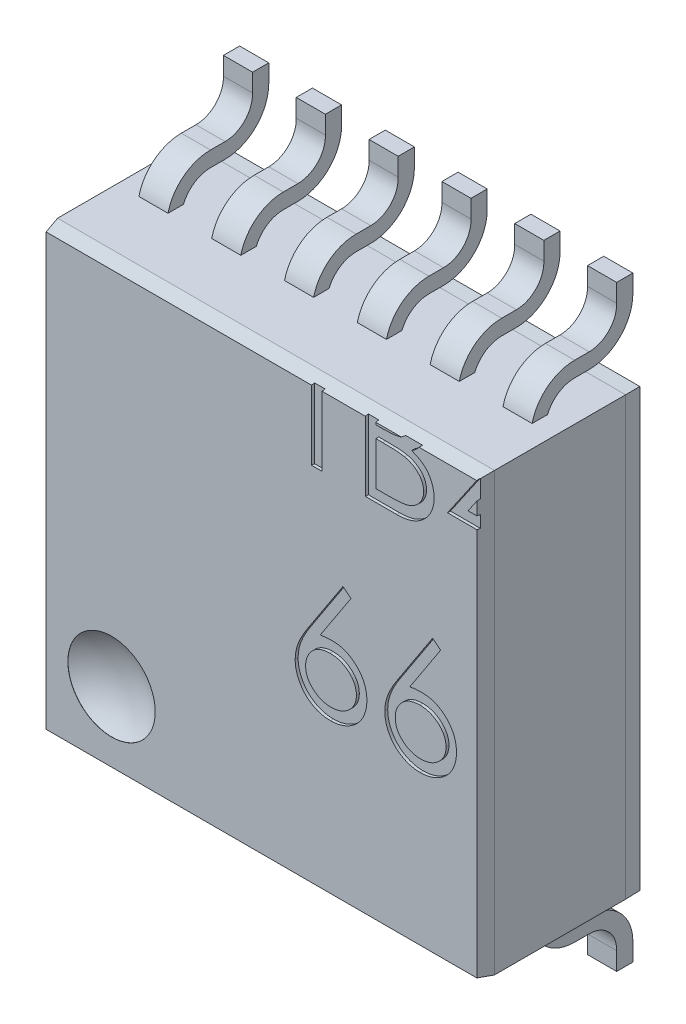
from build123d import *
from OCP.BRepFilletAPI import BRepFilletAPI_MakeChamfer

# Parameters (mm, degrees)
SKETCH1_W          = 3
SKETCH1_H          = 3
EXTRUDE2_DEPTH     = 1.1
CHAMFER2_SIZE      = 0.1
CHAMFER2_SIZE2     = 0.021255656
CHAMFER3_SIZE      = 0.1
CHAMFER3_SIZE2     = 0.001745506
SKETCH2_W          = 0.2
SKETCH2_H          = 0.548769717
EXTRUDE3_DEPTH     = 0.7
EXTRUDE3_2_DEPTH   = 0.7
EXTRUDE3_3_DEPTH   = 0.7
EXTRUDE3_4_DEPTH   = 0.7
EXTRUDE3_5_DEPTH   = 0.7
EXTRUDE3_6_DEPTH   = 0.7
EXTRUDE4_DEPTH     = 5.17080471
MIRROR1_START      = -3.15
MIRROR1_DEPTH      = 0.2
MIRROR1_START_2    = -2.65
MIRROR1_2_DEPTH    = 0.2
MIRROR1_START_3    = -2.15
MIRROR1_3_DEPTH    = 0.2
MIRROR1_START_4    = -1.65
MIRROR1_4_DEPTH    = 0.2
MIRROR1_START_5    = -1.15
MIRROR1_5_DEPTH    = 0.2
MIRROR1_START_6    = -0.65
MIRROR1_6_DEPTH    = 0.2
SKETCH4_R          = 0.3
EXTRUDE5_DEPTH     = 0.001
DOME1_FACE_RADIUS  = 0.3
DOME1_HEIGHT       = 0.1
CUT_EXTRUDE1_DEPTH = 0.02


# Read off the part's stored shape, not the designer's step: Mirror1
with BuildPart() as part:
    # Sketch1 → Extrude2 (new body)
    with BuildSketch(Plane.XY.offset(0.1)):
        with Locations((-1.8, -0.75)):
            Rectangle(SKETCH1_W, SKETCH1_H)
    extrude(amount=EXTRUDE2_DEPTH)

    # Chamfer2: one chamfer whose edges measure the first distance from different faces: ONE call of the kernel's chamfer builder (chamfer() names one face for all edges)
    chamfer2_edges_1 = [part.edges().sort_by_distance(p)[0] for p in [
        (-0.3, -0.75, 1.2),
    ]]
    chamfer2_side_1 = [part.faces().sort_by_distance(p)[0] for p in [
        (-0.3, -0.75, 0.65),
    ]]
    chamfer2_edges_2 = [part.edges().sort_by_distance(p)[0] for p in [
        (-1.8, 0.75, 1.2),
    ]]
    chamfer2_side_2 = [part.faces().sort_by_distance(p)[0] for p in [
        (-1.8, 0.75, 0.65),
    ]]
    chamfer2_edges_3 = [part.edges().sort_by_distance(p)[0] for p in [
        (-3.3, -0.75, 1.2),
    ]]
    chamfer2_side_3 = [part.faces().sort_by_distance(p)[0] for p in [
        (-3.3, -0.75, 0.65),
    ]]
    chamfer2_edges_4 = [part.edges().sort_by_distance(p)[0] for p in [
        (-1.8, -2.25, 1.2),
    ]]
    chamfer2_side_4 = [part.faces().sort_by_distance(p)[0] for p in [
        (-1.8, -2.25, 0.65),
    ]]
    chamfer2 = BRepFilletAPI_MakeChamfer(part.part.solid().wrapped)
    for e in chamfer2_edges_1:
        chamfer2.Add(CHAMFER2_SIZE, CHAMFER2_SIZE2, e.wrapped, chamfer2_side_1[0].wrapped)  # the first distance lies on this face
    for e in chamfer2_edges_2:
        chamfer2.Add(CHAMFER2_SIZE, CHAMFER2_SIZE2, e.wrapped, chamfer2_side_2[0].wrapped)  # the first distance lies on this face
    for e in chamfer2_edges_3:
        chamfer2.Add(CHAMFER2_SIZE, CHAMFER2_SIZE2, e.wrapped, chamfer2_side_3[0].wrapped)  # the first distance lies on this face
    for e in chamfer2_edges_4:
        chamfer2.Add(CHAMFER2_SIZE, CHAMFER2_SIZE2, e.wrapped, chamfer2_side_4[0].wrapped)  # the first distance lies on this face
    add(Compound.cast(chamfer2.Shape()), mode=Mode.REPLACE)

    # Chamfer3: one chamfer whose edges measure the first distance from different faces: ONE call of the kernel's chamfer builder (chamfer() names one face for all edges)
    chamfer3_edges_1 = [part.edges().sort_by_distance(p)[0] for p in [
        (-1.8, 0.75, 0.1),
    ]]
    chamfer3_side_1 = [part.faces().sort_by_distance(p)[0] for p in [
        (-1.8, 0.75, 0.6),
    ]]
    chamfer3_edges_2 = [part.edges().sort_by_distance(p)[0] for p in [
        (-0.3, -0.75, 0.1),
    ]]
    chamfer3_side_2 = [part.faces().sort_by_distance(p)[0] for p in [
        (-0.3, -0.75, 0.6),
    ]]
    chamfer3_edges_3 = [part.edges().sort_by_distance(p)[0] for p in [
        (-1.8, -2.25, 0.1),
    ]]
    chamfer3_side_3 = [part.faces().sort_by_distance(p)[0] for p in [
        (-1.8, -2.25, 0.6),
    ]]
    chamfer3_edges_4 = [part.edges().sort_by_distance(p)[0] for p in [
        (-3.3, -0.75, 0.1),
    ]]
    chamfer3_side_4 = [part.faces().sort_by_distance(p)[0] for p in [
        (-3.3, -0.75, 0.6),
    ]]
    chamfer3 = BRepFilletAPI_MakeChamfer(part.part.solid().wrapped)
    for e in chamfer3_edges_1:
        chamfer3.Add(CHAMFER3_SIZE, CHAMFER3_SIZE2, e.wrapped, chamfer3_side_1[0].wrapped)  # the first distance lies on this face
    for e in chamfer3_edges_2:
        chamfer3.Add(CHAMFER3_SIZE, CHAMFER3_SIZE2, e.wrapped, chamfer3_side_2[0].wrapped)  # the first distance lies on this face
    for e in chamfer3_edges_3:
        chamfer3.Add(CHAMFER3_SIZE, CHAMFER3_SIZE2, e.wrapped, chamfer3_side_3[0].wrapped)  # the first distance lies on this face
    for e in chamfer3_edges_4:
        chamfer3.Add(CHAMFER3_SIZE, CHAMFER3_SIZE2, e.wrapped, chamfer3_side_4[0].wrapped)  # the first distance lies on this face
    add(Compound.cast(chamfer3.Shape()), mode=Mode.REPLACE)

    # Mirror1 outline → Mirror1 (add)
    with BuildSketch(Plane.YZ.offset(MIRROR1_START)):
        with BuildLine():
            ThreePointArc((0.875, 0.3), (0.962867966, 0.087867966), (1.175, 0))
            Line((1.175, 0), (1.298769717, 0))
            Line((1.298769717, 0), (1.298769717, 0.111270078))
            Line((1.298769717, 0.111270078), (1.175, 0.111270078))
            ThreePointArc((1.175, 0.111270078), (1.037816324, 0.164485937), (0.980481976, 0.3))
            Line((0.980481976, 0.3), (0.980481976, 0.400050091))
            ThreePointArc((0.980481976, 0.400050091), (0.915912865, 0.585986361), (0.75, 0.691884367))
            Line((0.75, 0.691884367), (0.75, 0.585404962))
            ThreePointArc((0.75, 0.585404962), (0.84083124, 0.511803399), (0.875, 0.4))
            Line((0.875, 0.4), (0.875, 0.3))
        make_face()
    extrude(amount=MIRROR1_DEPTH)

    # Mirror1 2 outline → Mirror1 2 (add)
    with BuildSketch(Plane.YZ.offset(MIRROR1_START_2)):
        with BuildLine():
            ThreePointArc((0.875, 0.3), (0.962867966, 0.087867966), (1.175, 0))
            Line((1.175, 0), (1.298769717, 0))
            Line((1.298769717, 0), (1.298769717, 0.111270078))
            Line((1.298769717, 0.111270078), (1.175, 0.111270078))
            ThreePointArc((1.175, 0.111270078), (1.037816324, 0.164485937), (0.980481976, 0.3))
            Line((0.980481976, 0.3), (0.980481976, 0.400050091))
            ThreePointArc((0.980481976, 0.400050091), (0.915912865, 0.585986361), (0.75, 0.691884367))
            Line((0.75, 0.691884367), (0.75, 0.585404962))
            ThreePointArc((0.75, 0.585404962), (0.84083124, 0.511803399), (0.875, 0.4))
            Line((0.875, 0.4), (0.875, 0.3))
        make_face()
    extrude(amount=MIRROR1_2_DEPTH)

    # Mirror1 3 outline → Mirror1 3 (add)
    with BuildSketch(Plane.YZ.offset(MIRROR1_START_3)):
        with BuildLine():
            ThreePointArc((0.875, 0.3), (0.962867966, 0.087867966), (1.175, 0))
            Line((1.175, 0), (1.298769717, 0))
            Line((1.298769717, 0), (1.298769717, 0.111270078))
            Line((1.298769717, 0.111270078), (1.175, 0.111270078))
            ThreePointArc((1.175, 0.111270078), (1.037816324, 0.164485937), (0.980481976, 0.3))
            Line((0.980481976, 0.3), (0.980481976, 0.400050091))
            ThreePointArc((0.980481976, 0.400050091), (0.915912865, 0.585986361), (0.75, 0.691884367))
            Line((0.75, 0.691884367), (0.75, 0.585404962))
            ThreePointArc((0.75, 0.585404962), (0.84083124, 0.511803399), (0.875, 0.4))
            Line((0.875, 0.4), (0.875, 0.3))
        make_face()
    extrude(amount=MIRROR1_3_DEPTH)

    # Mirror1 4 outline → Mirror1 4 (add)
    with BuildSketch(Plane.YZ.offset(MIRROR1_START_4)):
        with BuildLine():
            ThreePointArc((0.875, 0.3), (0.962867966, 0.087867966), (1.175, 0))
            Line((1.175, 0), (1.298769717, 0))
            Line((1.298769717, 0), (1.298769717, 0.111270078))
            Line((1.298769717, 0.111270078), (1.175, 0.111270078))
            ThreePointArc((1.175, 0.111270078), (1.037816324, 0.164485937), (0.980481976, 0.3))
            Line((0.980481976, 0.3), (0.980481976, 0.400050091))
            ThreePointArc((0.980481976, 0.400050091), (0.915912865, 0.585986361), (0.75, 0.691884367))
            Line((0.75, 0.691884367), (0.75, 0.585404962))
            ThreePointArc((0.75, 0.585404962), (0.84083124, 0.511803399), (0.875, 0.4))
            Line((0.875, 0.4), (0.875, 0.3))
        make_face()
    extrude(amount=MIRROR1_4_DEPTH)

    # Mirror1 5 outline → Mirror1 5 (add)
    with BuildSketch(Plane.YZ.offset(MIRROR1_START_5)):
        with BuildLine():
            ThreePointArc((0.875, 0.3), (0.962867966, 0.087867966), (1.175, 0))
            Line((1.175, 0), (1.298769717, 0))
            Line((1.298769717, 0), (1.298769717, 0.111270078))
            Line((1.298769717, 0.111270078), (1.175, 0.111270078))
            ThreePointArc((1.175, 0.111270078), (1.037816324, 0.164485937), (0.980481976, 0.3))
            Line((0.980481976, 0.3), (0.980481976, 0.400050091))
            ThreePointArc((0.980481976, 0.400050091), (0.915912865, 0.585986361), (0.75, 0.691884367))
            Line((0.75, 0.691884367), (0.75, 0.585404962))
            ThreePointArc((0.75, 0.585404962), (0.84083124, 0.511803399), (0.875, 0.4))
            Line((0.875, 0.4), (0.875, 0.3))
        make_face()
    extrude(amount=MIRROR1_5_DEPTH)

    # Mirror1 6 outline → Mirror1 6 (add)
    with BuildSketch(Plane.YZ.offset(MIRROR1_START_6)):
        with BuildLine():
            ThreePointArc((0.875, 0.3), (0.962867966, 0.087867966), (1.175, 0))
            Line((1.175, 0), (1.298769717, 0))
            Line((1.298769717, 0), (1.298769717, 0.111270078))
            Line((1.298769717, 0.111270078), (1.175, 0.111270078))
            ThreePointArc((1.175, 0.111270078), (1.037816324, 0.164485937), (0.980481976, 0.3))
            Line((0.980481976, 0.3), (0.980481976, 0.400050091))
            ThreePointArc((0.980481976, 0.400050091), (0.915912865, 0.585986361), (0.75, 0.691884367))
            Line((0.75, 0.691884367), (0.75, 0.585404962))
            ThreePointArc((0.75, 0.585404962), (0.84083124, 0.511803399), (0.875, 0.4))
            Line((0.875, 0.4), (0.875, 0.3))
        make_face()
    extrude(amount=MIRROR1_6_DEPTH)

    # Sketch4 → Extrude5 (cut)
    with BuildSketch(Plane.XY.offset(1.2)):
        with Locations((-2.829613335, -1.750129606)):
            Circle(SKETCH4_R)
    extrude(amount=-EXTRUDE5_DEPTH, mode=Mode.SUBTRACT)

    # Dome1: a dome of height H over a round flat face of radius A is a cap of a sphere of radius (A * A + H * H) / (2 * H)
    dome1_r = (DOME1_FACE_RADIUS * DOME1_FACE_RADIUS + DOME1_HEIGHT * DOME1_HEIGHT) / (2 * DOME1_HEIGHT)
    dome1_base = Plane((-2.829613335, -1.750129606, 1.199), z_dir=(0, 0, -1))
    with Locations(dome1_base.offset(DOME1_HEIGHT - dome1_r)):
        dome1_ball = Sphere(dome1_r, mode=Mode.PRIVATE)
    add(split(dome1_ball, bisect_by=dome1_base, keep=Keep.TOP, mode=Mode.PRIVATE), mode=Mode.SUBTRACT)

    # Sketch5 → Cut-Extrude1 (cut)
    # profile 1 of 14: a face of its own
    with BuildSketch(Plane.XY.offset(1.2)):
        Polygon((-1.630273204, 0.970399683), (-1.630273204, 1.052450965), (-1.209760384, 1.052450965), (-1.209760384, 0.970399683), (-1.384119358, 0.970399683), (-1.384119358, 0.252450965), (-1.45591423, 0.252450965), (-1.45591423, 0.970399683), align=None)
    # profile 2 of 14: a face of its own
    with BuildSketch(Plane.XY.offset(1.2)):
        with BuildLine():
            Line((-1.086683461, 1.052450965), (-0.930593717, 1.052450965))
            add(Edge.make_bspline(
                [(-0.930593717, 1.052450965), (-0.922952922, 1.052410794), (-0.90814316, 1.052332931), (-0.886607287, 1.051125358), (-0.866436131, 1.049478805), (-0.84762384, 1.046866213), (-0.830179108, 1.043713807), (-0.814049362, 1.039896249), (-0.799285894, 1.035318737), (-0.781660126, 1.028039587), (-0.761563975, 1.017222863), (-0.739804342, 1.001239191), (-0.721197659, 0.981688913), (-0.705155072, 0.959635735), (-0.692400531, 0.93537613), (-0.683173263, 0.909488315), (-0.677331463, 0.882306203), (-0.676730678, 0.863644905), (-0.676427051, 0.854213786)],
                knots=[0, 0, 0, 0, 1.001505555, 1.941167018, 2.826882275, 3.653841531, 4.429895133, 5.150066043, 5.825578002, 6.45369114, 7.647487171, 8.808567382, 9.977351308, 11.170798116, 12.373658725, 13.556498008, 14.765093433, 16, 16, 16, 16], degree=3))
            add(Edge.make_bspline(
                [(-0.676427051, 0.854213786), (-0.676676929, 0.845378916), (-0.677167964, 0.828017563), (-0.681863452, 0.802624624), (-0.689214462, 0.778452917), (-0.699432804, 0.755590657), (-0.712713261, 0.734554403), (-0.728452305, 0.715174457), (-0.747441288, 0.698271358), (-0.761668315, 0.688821551), (-0.768894999, 0.684021478)],
                knots=[0, 0, 0, 0, 1.044552857, 2.05264487, 3.044412934, 4.028983338, 5.005914585, 5.980388656, 6.974128949, 8, 8, 8, 8], degree=3))
            add(Edge.make_bspline(
                [(-0.768894999, 0.684021478), (-0.759806902, 0.680532335), (-0.742419119, 0.673856741), (-0.718490888, 0.66205435), (-0.697874923, 0.649217296), (-0.680412719, 0.635198587), (-0.665478397, 0.620088002), (-0.652437725, 0.603663976), (-0.641310554, 0.58571226), (-0.631776171, 0.566420023), (-0.624336456, 0.545984259), (-0.61876482, 0.524596653), (-0.615572261, 0.502333897), (-0.615117943, 0.487182953), (-0.614888589, 0.479534299)],
                knots=[0, 0, 0, 0, 1.27268992, 2.434971085, 3.483601985, 4.442670788, 5.356604649, 6.2567628, 7.179492994, 8.113709626, 9.066344395, 10.018646069, 10.999752585, 12, 12, 12, 12], degree=3))
            add(Edge.make_bspline(
                [(-0.614888589, 0.479534299), (-0.615111868, 0.471724728), (-0.615551176, 0.456359179), (-0.618792312, 0.433786576), (-0.624280108, 0.41221516), (-0.631839227, 0.391505404), (-0.641704899, 0.371697373), (-0.653711291, 0.352768627), (-0.668027077, 0.334909352), (-0.684041447, 0.317921095), (-0.702158509, 0.302646172), (-0.721704967, 0.289042582), (-0.742926983, 0.277854911), (-0.765476011, 0.268456963), (-0.789604997, 0.261278175), (-0.815205593, 0.256255872), (-0.842255719, 0.252871864), (-0.860817948, 0.252593645), (-0.870337307, 0.252450965)],
                knots=[0, 0, 0, 0, 0.978564426, 1.925352924, 2.850884081, 3.763762016, 4.682927383, 5.618979971, 6.567305752, 7.547517671, 8.540179244, 9.531824382, 10.526200242, 11.540722885, 12.589160233, 13.674978461, 14.80764778, 16, 16, 16, 16], degree=3))
            Line((-0.870337307, 0.252450965), (-1.086683461, 0.252450965))
            Line((-1.086683461, 0.252450965), (-1.086683461, 1.052450965))
        make_face()
        with BuildLine():
            Line((-1.014888589, 0.970399683), (-1.014888589, 0.713989427))
            Line((-1.014888589, 0.713989427), (-0.96665141, 0.713989427))
            add(Edge.make_bspline(
                [(-0.96665141, 0.713989427), (-0.959600256, 0.714080838), (-0.945975991, 0.714257462), (-0.926245729, 0.714763409), (-0.907931439, 0.716180105), (-0.891064735, 0.717596393), (-0.875672176, 0.719899156), (-0.861787865, 0.722640213), (-0.8491939, 0.725539163), (-0.834670575, 0.730469331), (-0.818196758, 0.737755657), (-0.800634906, 0.749063505), (-0.785152742, 0.762531929), (-0.772079099, 0.77807272), (-0.761379334, 0.795184991), (-0.753947628, 0.813595706), (-0.748908248, 0.832846022), (-0.748453041, 0.846061623), (-0.748221922, 0.852771478)],
                knots=[0, 0, 0, 0, 1.156816544, 2.235205308, 3.236616184, 4.169592532, 5.011045266, 5.787822928, 6.49130361, 7.128639758, 8.301311294, 9.436451833, 10.541879658, 11.654887649, 12.756523258, 13.837046038, 14.901820046, 16, 16, 16, 16], degree=3))
            add(Edge.make_bspline(
                [(-0.748221922, 0.852771478), (-0.748342192, 0.857211654), (-0.748578114, 0.865921545), (-0.750510298, 0.87861854), (-0.753794315, 0.89055997), (-0.758012439, 0.90190948), (-0.763906996, 0.912312189), (-0.770847217, 0.922127777), (-0.779232517, 0.931021975), (-0.788777046, 0.939335003), (-0.799750445, 0.946705181), (-0.812146169, 0.953160213), (-0.826131924, 0.958358105), (-0.841472005, 0.962910368), (-0.858402539, 0.966107692), (-0.876728152, 0.968771324), (-0.896598945, 0.970127379), (-0.910346397, 0.970306891), (-0.917452692, 0.970399683)],
                knots=[0, 0, 0, 0, 0.91205012, 1.789085906, 2.630437955, 3.453916878, 4.269457761, 5.079663411, 5.91843418, 6.774407191, 7.675494373, 8.627863946, 9.638891023, 10.736472738, 11.911756761, 13.175263542, 14.539845004, 16, 16, 16, 16], degree=3))
            Line((-0.917452692, 0.970399683), (-1.014888589, 0.970399683))
        make_face(mode=Mode.SUBTRACT)
        with BuildLine():
            Line((-1.014888589, 0.631938145), (-1.014888589, 0.334502247))
            Line((-1.014888589, 0.334502247), (-0.912644999, 0.334502247))
            add(Edge.make_bspline(
                [(-0.912644999, 0.334502247), (-0.905326388, 0.334589961), (-0.891220729, 0.334759018), (-0.870854733, 0.335310916), (-0.851978595, 0.336566293), (-0.83467845, 0.338542487), (-0.818767489, 0.340686133), (-0.804436586, 0.343568711), (-0.79156957, 0.346871331), (-0.776649728, 0.351976284), (-0.759848926, 0.359906906), (-0.741743588, 0.371864444), (-0.725646166, 0.386109771), (-0.711976393, 0.402596837), (-0.700773424, 0.420523998), (-0.692623606, 0.439528649), (-0.687597124, 0.45929677), (-0.686988628, 0.472774876), (-0.686683461, 0.479534299)],
                knots=[0, 0, 0, 0, 1.160039823, 2.235823828, 3.228722157, 4.157150951, 4.99529583, 5.772374946, 6.472645482, 7.099169577, 8.269452708, 9.405989375, 10.527446681, 11.663510218, 12.788923519, 13.866172445, 14.929861265, 16, 16, 16, 16], degree=3))
            add(Edge.make_bspline(
                [(-0.686683461, 0.479534299), (-0.68674657, 0.483761348), (-0.686871772, 0.492147264), (-0.688759912, 0.504470879), (-0.69150594, 0.516408222), (-0.695055982, 0.527991705), (-0.700226145, 0.539011906), (-0.706261927, 0.549686777), (-0.713338819, 0.560030429), (-0.724366057, 0.573107515), (-0.740405368, 0.588174261), (-0.763195488, 0.60292569), (-0.789109156, 0.614822332), (-0.807904011, 0.619873641), (-0.817612948, 0.622483017)],
                knots=[0, 0, 0, 0, 0.723448775, 1.435228256, 2.130040452, 2.821711965, 3.505591119, 4.210454504, 4.921174351, 5.648778258, 7.137944449, 8.670945889, 10.280296675, 12, 12, 12, 12], degree=3))
            add(Edge.make_bspline(
                [(-0.817612948, 0.622483017), (-0.821505313, 0.62327275), (-0.829944762, 0.624985055), (-0.843706495, 0.62679253), (-0.859417551, 0.62840283), (-0.877114209, 0.629593951), (-0.896818858, 0.630825161), (-0.918573582, 0.631303977), (-0.94228954, 0.631875237), (-0.958744939, 0.631916639), (-0.967292435, 0.631938145)],
                knots=[0, 0, 0, 0, 0.634451884, 1.375622551, 2.216452059, 3.157844607, 4.20941857, 5.370758133, 6.634282058, 8, 8, 8, 8], degree=3))
            Line((-0.967292435, 0.631938145), (-1.014888589, 0.631938145))
        make_face(mode=Mode.SUBTRACT)
    # profile 3 of 14: a face of its own
    with BuildSketch(Plane.XY.offset(1.2)):
        Polygon((-0.085882179, 1.072963786), (-0.071298845, 1.072963786), (-0.071298845, 0.519117632), (0.021008847, 0.519117632), (0.021008847, 0.43706635), (-0.071298845, 0.43706635), (-0.071298845, 0.252450965), (-0.143093717, 0.252450965), (-0.143093717, 0.43706635), (-0.522580897, 0.43706635), align=None)
        Polygon((-0.143093717, 0.519117632), (-0.143093717, 0.866553529), (-0.381555256, 0.519117632), align=None, mode=Mode.SUBTRACT)
    # profile 4 of 14: a face of its own
    with BuildSketch(Plane.XY.offset(1.2)):
        Polygon((0.529502437, 1.072963786), (0.54408577, 1.072963786), (0.54408577, 0.519117632), (0.636393462, 0.519117632), (0.636393462, 0.43706635), (0.54408577, 0.43706635), (0.54408577, 0.252450965), (0.472290898, 0.252450965), (0.472290898, 0.43706635), (0.092803719, 0.43706635), align=None)
        Polygon((0.472290898, 0.519117632), (0.472290898, 0.866553529), (0.23382936, 0.519117632), align=None, mode=Mode.SUBTRACT)
    # profile 5 of 14: a face of its own
    with BuildSketch(Plane.XY.offset(1.2)):
        with BuildLine():
            Line((1.210752437, 1.052450965), (1.210752437, 0.970399683))
            Line((1.210752437, 0.970399683), (0.938637052, 0.970399683))
            Line((0.938637052, 0.970399683), (0.895528078, 0.759983017))
            add(Edge.make_bspline(
                [(0.895528078, 0.759983017), (0.903997992, 0.762321364), (0.920407111, 0.766851543), (0.944626508, 0.771881434), (0.967619011, 0.774913535), (0.982539096, 0.775327549), (0.989758847, 0.775527888)],
                knots=[0, 0, 0, 0, 1.100273476, 2.13160584, 3.095893838, 4, 4, 4, 4], degree=3))
            add(Edge.make_bspline(
                [(0.989758847, 0.775527888), (0.998692273, 0.775334532), (1.016257621, 0.774954344), (1.041957952, 0.771303635), (1.066491184, 0.765557369), (1.089806012, 0.757529821), (1.111945566, 0.74726474), (1.132706152, 0.734441896), (1.152399389, 0.719462849), (1.170671982, 0.702241132), (1.187248967, 0.68328762), (1.20182405, 0.662908678), (1.214204071, 0.641302355), (1.224160815, 0.618262216), (1.23211152, 0.594042981), (1.237403404, 0.568389819), (1.240927223, 0.541544534), (1.241320912, 0.523189204), (1.241521667, 0.51382917)],
                knots=[0, 0, 0, 0, 1.052922333, 2.070308379, 3.05430497, 4.020497103, 4.973039431, 5.925935799, 6.892292201, 7.88610001, 8.88166317, 9.857072816, 10.836096531, 11.812156883, 12.81219415, 13.836441305, 14.89672472, 16, 16, 16, 16], degree=3))
            add(Edge.make_bspline(
                [(1.241521667, 0.51382917), (1.24136965, 0.507309806), (1.24106767, 0.49435918), (1.239531993, 0.47512622), (1.236575258, 0.456300429), (1.232605492, 0.437879311), (1.22745294, 0.41989774), (1.221215442, 0.402304248), (1.213582064, 0.385208338), (1.205209178, 0.368448248), (1.195781412, 0.352402875), (1.185317753, 0.337397392), (1.174262783, 0.323206699), (1.16236761, 0.309982989), (1.149521668, 0.297813156), (1.135880533, 0.286624978), (1.121553054, 0.276229245), (1.10631757, 0.267047943), (1.090513574, 0.258599268), (1.073912839, 0.251668173), (1.05689325, 0.245471481), (1.03920985, 0.240532161), (1.020902693, 0.236661862), (1.001941601, 0.234033154), (0.982426019, 0.232118539), (0.969197445, 0.231998686), (0.962515257, 0.231938145)],
                knots=[0, 0, 0, 0, 1.056347294, 2.098418968, 3.122841568, 4.141288669, 5.149314143, 6.15115421, 7.162517403, 8.180376062, 9.185164535, 10.17417709, 11.141909838, 12.097768115, 13.052685741, 14.0056014, 14.954263652, 15.917497458, 16.885230207, 17.854509472, 18.828990115, 19.81800267, 20.826176721, 21.857883937, 22.917946725, 24, 24, 24, 24], degree=3))
            add(Edge.make_bspline(
                [(0.962515257, 0.231938145), (0.954544016, 0.232096051), (0.93886154, 0.232406712), (0.915885411, 0.235656651), (0.893779215, 0.240311261), (0.872720906, 0.247313837), (0.85252176, 0.256088075), (0.83345371, 0.267177486), (0.815029533, 0.279744138), (0.79799821, 0.294573933), (0.782191099, 0.310783232), (0.76804104, 0.32837355), (0.755439079, 0.347054565), (0.744587023, 0.366917), (0.735330332, 0.387908665), (0.728058335, 0.410108208), (0.722188996, 0.433399637), (0.719705929, 0.449434725), (0.718444744, 0.45757917)],
                knots=[0, 0, 0, 0, 1.0467383, 2.05933395, 3.04377827, 4.011590433, 4.970194871, 5.932262533, 6.905835911, 7.896367577, 8.894135286, 9.877477877, 10.858688626, 11.851381753, 12.8477658, 13.868841284, 14.917554742, 16, 16, 16, 16], degree=3))
            Line((0.718444744, 0.45757917), (0.790239616, 0.45757917))
            add(Edge.make_bspline(
                [(0.790239616, 0.45757917), (0.792006143, 0.449950267), (0.795401507, 0.435287091), (0.80285425, 0.414685642), (0.81196645, 0.396326962), (0.82280173, 0.3799682), (0.835727451, 0.365703286), (0.850477035, 0.352990815), (0.867013657, 0.341522214), (0.885389252, 0.331962724), (0.904775099, 0.323809866), (0.925064747, 0.318380908), (0.945705741, 0.314563561), (0.959666511, 0.314181444), (0.966681924, 0.313989427)],
                knots=[0, 0, 0, 0, 1.136247022, 2.183929868, 3.172523383, 4.106158343, 5.02341133, 5.958108904, 6.928429099, 7.938127109, 8.96079061, 9.975095812, 10.982467395, 12, 12, 12, 12], degree=3))
            add(Edge.make_bspline(
                [(0.966681924, 0.313989427), (0.973529568, 0.314177033), (0.987012636, 0.314546432), (1.006855239, 0.317389634), (1.026012467, 0.321768508), (1.044295292, 0.328321618), (1.062023644, 0.336286125), (1.078749077, 0.346506713), (1.094955449, 0.358269003), (1.110139022, 0.371744804), (1.124045182, 0.38659502), (1.136332295, 0.402475567), (1.146567018, 0.419416561), (1.155191958, 0.43712471), (1.161741283, 0.455794095), (1.166413507, 0.47533722), (1.169157064, 0.495802359), (1.169534476, 0.509761058), (1.169726796, 0.516874042)],
                knots=[0, 0, 0, 0, 1.027316725, 2.022795036, 3.002884548, 3.971462791, 4.93288096, 5.914575861, 6.907176829, 7.935150275, 8.956128384, 9.956726525, 10.942570165, 11.921478529, 12.907843606, 13.90538589, 14.932640048, 16, 16, 16, 16], degree=3))
            add(Edge.make_bspline(
                [(1.169726796, 0.516874042), (1.169576286, 0.523291357), (1.169281685, 0.535852337), (1.166874697, 0.554229299), (1.162687961, 0.571617423), (1.156876788, 0.588100676), (1.149498615, 0.603694606), (1.140482315, 0.618415305), (1.129658681, 0.632068753), (1.117294821, 0.644661337), (1.103750126, 0.656283022), (1.088791556, 0.666190242), (1.072732144, 0.674524852), (1.055765379, 0.681717537), (1.037487688, 0.686883422), (1.018261029, 0.690761796), (0.997877781, 0.693005307), (0.983941624, 0.693316596), (0.976778078, 0.693476606)],
                knots=[0, 0, 0, 0, 1.045622112, 2.046656509, 3.013763289, 3.955457236, 4.890082067, 5.820317437, 6.762574623, 7.722996705, 8.69280354, 9.665887285, 10.63943826, 11.638615906, 12.663482002, 13.728887084, 14.832589034, 16, 16, 16, 16], degree=3))
            add(Edge.make_bspline(
                [(0.976778078, 0.693476606), (0.97057718, 0.6933439), (0.957773898, 0.693069894), (0.938134395, 0.691052409), (0.917496287, 0.687797713), (0.895938688, 0.683320857), (0.873396858, 0.677462325), (0.849918366, 0.670441868), (0.825453848, 0.662048268), (0.808969797, 0.655709476), (0.800496026, 0.652450965)],
                knots=[0, 0, 0, 0, 0.817624296, 1.688186739, 2.600797293, 3.572016777, 4.590301741, 5.671205678, 6.80286297, 8, 8, 8, 8], degree=3))
            Line((0.800496026, 0.652450965), (0.882547308, 1.052450965))
            Line((0.882547308, 1.052450965), (1.210752437, 1.052450965))
        make_face()
    # profile 6 of 14: a face of its own
    with BuildSketch(Plane.XY.offset(1.2)):
        Polygon((1.723572949, 1.052450965), (2.092803719, 0.252450965), (2.014758847, 0.252450965), (1.896489616, 0.508861222), (1.53382936, 0.508861222), (1.412194744, 0.252450965), (1.33382936, 0.252450965), (1.713316539, 1.052450965), align=None)
        Polygon((1.717643462, 0.896521478), (1.572771667, 0.590912504), (1.858669103, 0.590912504), align=None, mode=Mode.SUBTRACT)
    # profile 7 of 14: a face of its own
    with BuildSketch(Plane.XY.offset(1.2)):
        Polygon((2.334630642, 1.052450965), (2.482547308, 1.052450965), (2.482547308, 0.252450965), (2.410752437, 0.252450965), (2.410752437, 0.970399683), (2.287675514, 0.970399683), align=None)
    # profile 8 of 14: a face of its own
    with BuildSketch(Plane.XY.offset(1.2)):
        with BuildLine():
            Line((-1.240529615, -0.360369548), (-1.185241153, -0.403799035))
            Line((-1.185241153, -0.403799035), (-1.396619358, -0.727036214))
            add(Edge.make_bspline(
                [(-1.396619358, -0.727036214), (-1.382546152, -0.724793046), (-1.355094772, -0.720417493), (-1.327308281, -0.719695677), (-1.313766794, -0.719343907)],
                knots=[0, 0, 0, 0, 1.025318673, 2, 2, 2, 2], degree=3))
            add(Edge.make_bspline(
                [(-1.313766794, -0.719343907), (-1.305635938, -0.719562446), (-1.289630589, -0.719992636), (-1.266131892, -0.72330323), (-1.243551563, -0.728520398), (-1.221983195, -0.736125485), (-1.20134937, -0.745840309), (-1.18153168, -0.75748348), (-1.162902649, -0.771656207), (-1.145222379, -0.787488196), (-1.129170471, -0.805023507), (-1.114958802, -0.823629527), (-1.103021249, -0.843286871), (-1.093335781, -0.863985583), (-1.085814666, -0.885693757), (-1.080331776, -0.908383618), (-1.077090726, -0.932070811), (-1.076650614, -0.948180108), (-1.076427051, -0.956363137)],
                knots=[0, 0, 0, 0, 1.04369286, 2.054478336, 3.041073146, 4.015093852, 4.984733326, 5.965804835, 6.960378782, 7.985147595, 9.009457201, 10.008161701, 10.986880575, 11.956520048, 12.937015923, 13.931873656, 14.949455224, 16, 16, 16, 16], degree=3))
            add(Edge.make_bspline(
                [(-1.076427051, -0.956363137), (-1.076752332, -0.967558498), (-1.077392408, -0.989588319), (-1.083770418, -1.021674423), (-1.093681194, -1.052241855), (-1.107847487, -1.08080258), (-1.12544346, -1.107317453), (-1.146901195, -1.130811274), (-1.171459707, -1.151764425), (-1.199228118, -1.169285938), (-1.229112224, -1.183595207), (-1.260506966, -1.193872977), (-1.293107457, -1.200200627), (-1.315234224, -1.200993908), (-1.326427051, -1.201395189)],
                knots=[0, 0, 0, 0, 1.031375318, 2.029502543, 3.004789286, 3.987476834, 4.960371455, 5.9300674, 6.912260825, 7.929083631, 8.949397511, 9.960523116, 10.96833055, 12, 12, 12, 12], degree=3))
            add(Edge.make_bspline(
                [(-1.326427051, -1.201395189), (-1.337192011, -1.201045884), (-1.358515512, -1.200353974), (-1.389883008, -1.194190331), (-1.420023126, -1.184200136), (-1.448724699, -1.170436873), (-1.475312268, -1.153052214), (-1.499098699, -1.132123693), (-1.51996539, -1.108098672), (-1.537331018, -1.080980878), (-1.551104442, -1.051840317), (-1.561433568, -1.021454681), (-1.567466995, -0.989934685), (-1.568310094, -0.968567568), (-1.568734743, -0.957805445)],
                knots=[0, 0, 0, 0, 1.012016664, 2.004627821, 2.994792927, 3.992885782, 4.990978636, 5.973936114, 6.964471063, 7.975201453, 8.993600317, 9.990122807, 10.98767138, 12, 12, 12, 12], degree=3))
            add(Edge.make_bspline(
                [(-1.568734743, -0.957805445), (-1.568464698, -0.949566683), (-1.567913319, -0.932744706), (-1.564063401, -0.907267213), (-1.557877162, -0.881198395), (-1.550949106, -0.859083151), (-1.543628967, -0.840966231), (-1.537536958, -0.826359719), (-1.52995433, -0.811328617), (-1.521868986, -0.7953575), (-1.51255313, -0.778857972), (-1.502423839, -0.761554276), (-1.491201061, -0.743721607), (-1.483333595, -0.731620077), (-1.479311666, -0.72543365)],
                knots=[0, 0, 0, 0, 1.173818275, 2.396712641, 3.66331629, 4.989737886, 5.693666774, 6.447286557, 7.243889047, 8.091586357, 8.998013824, 9.943181721, 10.948533338, 12, 12, 12, 12], degree=3))
            Line((-1.479311666, -0.72543365), (-1.240529615, -0.360369548))
        make_face()
        with BuildLine():
            add(Edge.make_bspline(
                [(-1.328830897, -0.801395189), (-1.334925124, -0.801573027), (-1.346828921, -0.801920398), (-1.364293473, -0.803937598), (-1.380822216, -0.807736242), (-1.396634132, -0.81257426), (-1.411433607, -0.819226388), (-1.425328199, -0.827306799), (-1.438371639, -0.836820212), (-1.450427308, -0.847631848), (-1.461357517, -0.859469113), (-1.470770347, -0.872147861), (-1.478889753, -0.885362536), (-1.485491311, -0.899223551), (-1.4906319, -0.913725608), (-1.494350357, -0.928802008), (-1.496419786, -0.94455385), (-1.496764068, -0.955235565), (-1.496939871, -0.96069006)],
                knots=[0, 0, 0, 0, 1.129588631, 2.206414736, 3.251139165, 4.268635594, 5.265702196, 6.250456724, 7.242448911, 8.251968645, 9.246821453, 10.222880186, 11.173611482, 12.116736599, 13.062300278, 14.020270554, 14.989073742, 16, 16, 16, 16], degree=3))
            add(Edge.make_bspline(
                [(-1.496939871, -0.96069006), (-1.496796703, -0.96609577), (-1.496515971, -0.976695562), (-1.493966869, -0.992315946), (-1.490073136, -1.007347925), (-1.484281046, -1.021714005), (-1.477372043, -1.035633163), (-1.468250826, -1.048601228), (-1.458144132, -1.061405816), (-1.446063233, -1.073063295), (-1.433097893, -1.083910523), (-1.419246189, -1.093391724), (-1.404809627, -1.10150285), (-1.389593302, -1.107859672), (-1.3738131, -1.113076652), (-1.357337545, -1.116747847), (-1.340155178, -1.118823396), (-1.328515878, -1.119168126), (-1.322580897, -1.119343907)],
                knots=[0, 0, 0, 0, 0.989467248, 1.94019797, 2.891935182, 3.827694429, 4.772920941, 5.730924762, 6.725747692, 7.756678648, 8.79901574, 9.819492441, 10.826891316, 11.826466727, 12.835195252, 13.867842842, 14.912794438, 16, 16, 16, 16], degree=3))
            add(Edge.make_bspline(
                [(-1.322580897, -1.119343907), (-1.316645926, -1.119168112), (-1.305006645, -1.118823355), (-1.287824139, -1.116748002), (-1.271349095, -1.113076083), (-1.255567036, -1.107861735), (-1.240357566, -1.101495196), (-1.22593363, -1.093442186), (-1.212212923, -1.083852216), (-1.199239071, -1.073081832), (-1.187208457, -1.061339466), (-1.176859365, -1.048715529), (-1.168017483, -1.035528353), (-1.160832526, -1.021768836), (-1.15510423, -1.007339238), (-1.151190752, -0.992318273), (-1.148646915, -0.976694953), (-1.14836546, -0.966095564), (-1.148221922, -0.96069006)],
                knots=[0, 0, 0, 0, 1.087397944, 2.132534446, 3.165364764, 4.174271784, 5.174024072, 6.181601208, 7.194203697, 8.236725232, 9.267838612, 10.269026844, 11.221737037, 12.171628256, 13.107553087, 14.05945871, 15.010357665, 16, 16, 16, 16], degree=3))
            add(Edge.make_bspline(
                [(-1.148221922, -0.96069006), (-1.148347704, -0.955228449), (-1.148594571, -0.944509081), (-1.151386788, -0.928809054), (-1.155259331, -0.913649007), (-1.161106881, -0.899124219), (-1.168703805, -0.885292007), (-1.177957155, -0.872082498), (-1.188661743, -0.859394419), (-1.201026895, -0.847608634), (-1.21448752, -0.836832159), (-1.228799653, -0.827319118), (-1.243772905, -0.819290551), (-1.259392091, -0.812591785), (-1.275836179, -0.80775762), (-1.292839685, -0.803951164), (-1.310620083, -0.80192556), (-1.322683308, -0.801574231), (-1.328830897, -0.801395189)],
                knots=[0, 0, 0, 0, 0.978206639, 1.919901502, 2.851605144, 3.780102724, 4.718870031, 5.675451981, 6.667674623, 7.690630536, 8.733308323, 9.756129687, 10.767539656, 11.776269907, 12.797430371, 13.836405707, 14.897401972, 16, 16, 16, 16], degree=3))
        make_face(mode=Mode.SUBTRACT)
    # profile 9 of 14: a face of its own
    with BuildSketch(Plane.XY.offset(1.2)):
        with BuildLine():
            Line((-0.625144999, -0.360369548), (-0.569856538, -0.403799035))
            Line((-0.569856538, -0.403799035), (-0.781234743, -0.727036214))
            add(Edge.make_bspline(
                [(-0.781234743, -0.727036214), (-0.767161537, -0.724793046), (-0.739710157, -0.720417493), (-0.711923666, -0.719695677), (-0.698382179, -0.719343907)],
                knots=[0, 0, 0, 0, 1.025318673, 2, 2, 2, 2], degree=3))
            add(Edge.make_bspline(
                [(-0.698382179, -0.719343907), (-0.690251322, -0.719562446), (-0.674245974, -0.719992636), (-0.650747276, -0.72330323), (-0.628166948, -0.728520398), (-0.606598579, -0.736125485), (-0.585964755, -0.745840309), (-0.566147064, -0.75748348), (-0.547518034, -0.771656207), (-0.529837764, -0.787488196), (-0.513785856, -0.805023507), (-0.499574186, -0.823629527), (-0.487636634, -0.843286871), (-0.477951166, -0.863985583), (-0.470430051, -0.885693757), (-0.464947161, -0.908383618), (-0.461706111, -0.932070811), (-0.461265999, -0.948180108), (-0.461042435, -0.956363137)],
                knots=[0, 0, 0, 0, 1.04369286, 2.054478336, 3.041073146, 4.015093852, 4.984733326, 5.965804835, 6.960378782, 7.985147595, 9.009457201, 10.008161701, 10.986880575, 11.956520048, 12.937015923, 13.931873656, 14.949455224, 16, 16, 16, 16], degree=3))
            add(Edge.make_bspline(
                [(-0.461042435, -0.956363137), (-0.461367716, -0.967558498), (-0.462007793, -0.989588319), (-0.468385803, -1.021674423), (-0.478296579, -1.052241855), (-0.492462871, -1.08080258), (-0.510058845, -1.107317453), (-0.53151658, -1.130811274), (-0.556075092, -1.151764425), (-0.583843503, -1.169285938), (-0.613727609, -1.183595207), (-0.645122351, -1.193872977), (-0.677722842, -1.200200627), (-0.699849609, -1.200993908), (-0.711042435, -1.201395189)],
                knots=[0, 0, 0, 0, 1.031375318, 2.029502543, 3.004789286, 3.987476834, 4.960371455, 5.9300674, 6.912260825, 7.929083631, 8.949397511, 9.960523116, 10.96833055, 12, 12, 12, 12], degree=3))
            add(Edge.make_bspline(
                [(-0.711042435, -1.201395189), (-0.721807395, -1.201045884), (-0.743130897, -1.200353974), (-0.774498392, -1.194190331), (-0.804638511, -1.184200136), (-0.833340083, -1.170436873), (-0.859927652, -1.153052214), (-0.883714083, -1.132123693), (-0.904580775, -1.108098672), (-0.921946402, -1.080980878), (-0.935719827, -1.051840317), (-0.946048952, -1.021454681), (-0.95208238, -0.989934685), (-0.952925478, -0.968567568), (-0.953350128, -0.957805445)],
                knots=[0, 0, 0, 0, 1.012016664, 2.004627821, 2.994792927, 3.992885782, 4.990978636, 5.973936114, 6.964471063, 7.975201453, 8.993600317, 9.990122807, 10.98767138, 12, 12, 12, 12], degree=3))
            add(Edge.make_bspline(
                [(-0.953350128, -0.957805445), (-0.953080083, -0.949566683), (-0.952528704, -0.932744706), (-0.948678786, -0.907267213), (-0.942492547, -0.881198395), (-0.935564491, -0.859083151), (-0.928244351, -0.840966231), (-0.922152342, -0.826359719), (-0.914569714, -0.811328617), (-0.90648437, -0.7953575), (-0.897168514, -0.778857972), (-0.887039223, -0.761554276), (-0.875816446, -0.743721607), (-0.86794898, -0.731620077), (-0.863927051, -0.72543365)],
                knots=[0, 0, 0, 0, 1.173818275, 2.396712641, 3.66331629, 4.989737886, 5.693666774, 6.447286557, 7.243889047, 8.091586357, 8.998013824, 9.943181721, 10.948533338, 12, 12, 12, 12], degree=3))
            Line((-0.863927051, -0.72543365), (-0.625144999, -0.360369548))
        make_face()
        with BuildLine():
            add(Edge.make_bspline(
                [(-0.713446281, -0.801395189), (-0.719540509, -0.801573027), (-0.731444305, -0.801920398), (-0.748908857, -0.803937598), (-0.7654376, -0.807736242), (-0.781249517, -0.81257426), (-0.796048992, -0.819226388), (-0.809943583, -0.827306799), (-0.822987024, -0.836820212), (-0.835042693, -0.847631848), (-0.845972902, -0.859469113), (-0.855385732, -0.872147861), (-0.863505137, -0.885362536), (-0.870106696, -0.899223551), (-0.875247285, -0.913725608), (-0.878965742, -0.928802008), (-0.881035171, -0.94455385), (-0.881379452, -0.955235565), (-0.881555256, -0.96069006)],
                knots=[0, 0, 0, 0, 1.129588631, 2.206414736, 3.251139165, 4.268635594, 5.265702196, 6.250456724, 7.242448911, 8.251968645, 9.246821453, 10.222880186, 11.173611482, 12.116736599, 13.062300278, 14.020270554, 14.989073742, 16, 16, 16, 16], degree=3))
            add(Edge.make_bspline(
                [(-0.881555256, -0.96069006), (-0.881412087, -0.96609577), (-0.881131356, -0.976695562), (-0.878582254, -0.992315946), (-0.874688521, -1.007347925), (-0.86889643, -1.021714005), (-0.861987427, -1.035633163), (-0.85286621, -1.048601228), (-0.842759516, -1.061405816), (-0.830678617, -1.073063295), (-0.817713277, -1.083910523), (-0.803861574, -1.093391724), (-0.789425012, -1.10150285), (-0.774208687, -1.107859672), (-0.758428484, -1.113076652), (-0.741952929, -1.116747847), (-0.724770562, -1.118823396), (-0.713131262, -1.119168126), (-0.707196281, -1.119343907)],
                knots=[0, 0, 0, 0, 0.989467248, 1.94019797, 2.891935182, 3.827694429, 4.772920941, 5.730924762, 6.725747692, 7.756678648, 8.79901574, 9.819492441, 10.826891316, 11.826466727, 12.835195252, 13.867842842, 14.912794438, 16, 16, 16, 16], degree=3))
            add(Edge.make_bspline(
                [(-0.707196281, -1.119343907), (-0.70126131, -1.119168112), (-0.689622029, -1.118823355), (-0.672439524, -1.116748002), (-0.65596448, -1.113076083), (-0.640182421, -1.107861735), (-0.624972951, -1.101495196), (-0.610549014, -1.093442186), (-0.596828307, -1.083852216), (-0.583854456, -1.073081832), (-0.571823841, -1.061339466), (-0.561474749, -1.048715529), (-0.552632867, -1.035528353), (-0.54544791, -1.021768836), (-0.539719615, -1.007339238), (-0.535806137, -0.992318273), (-0.533262299, -0.976694953), (-0.532980844, -0.966095564), (-0.532837307, -0.96069006)],
                knots=[0, 0, 0, 0, 1.087397944, 2.132534446, 3.165364764, 4.174271784, 5.174024072, 6.181601208, 7.194203697, 8.236725232, 9.267838612, 10.269026844, 11.221737037, 12.171628256, 13.107553087, 14.05945871, 15.010357665, 16, 16, 16, 16], degree=3))
            add(Edge.make_bspline(
                [(-0.532837307, -0.96069006), (-0.532963088, -0.955228449), (-0.533209956, -0.944509081), (-0.536002173, -0.928809054), (-0.539874715, -0.913649007), (-0.545722265, -0.899124219), (-0.55331919, -0.885292007), (-0.56257254, -0.872082498), (-0.573277127, -0.859394419), (-0.585642279, -0.847608634), (-0.599102904, -0.836832159), (-0.613415038, -0.827319118), (-0.628388289, -0.819290551), (-0.644007476, -0.812591785), (-0.660451563, -0.80775762), (-0.67745507, -0.803951164), (-0.695235468, -0.80192556), (-0.707298693, -0.801574231), (-0.713446281, -0.801395189)],
                knots=[0, 0, 0, 0, 0.978206639, 1.919901502, 2.851605144, 3.780102724, 4.718870031, 5.675451981, 6.667674623, 7.690630536, 8.733308323, 9.756129687, 10.767539656, 11.776269907, 12.797430371, 13.836405707, 14.897401972, 16, 16, 16, 16], degree=3))
        make_face(mode=Mode.SUBTRACT)
    # profile 10 of 14: a face of its own
    with BuildSketch(Plane.XY.offset(1.2)):
        Polygon((-0.208959102, -0.380882368), (-0.061042435, -0.380882368), (-0.061042435, -1.180882368), (-0.132837307, -1.180882368), (-0.132837307, -0.46293365), (-0.25591423, -0.46293365), align=None)
    # profile 11 of 14: a face of its own
    with BuildSketch(Plane.XY.offset(1.2)):
        with BuildLine():
            Line((0.338957565, -0.627036214), (0.267162693, -0.627036214))
            add(Edge.make_bspline(
                [(0.267162693, -0.627036214), (0.267630614, -0.61751144), (0.268549597, -0.598805037), (0.272853206, -0.571531001), (0.279011121, -0.545461333), (0.287717739, -0.520805352), (0.298530603, -0.497345053), (0.311497466, -0.475173621), (0.326856061, -0.454375635), (0.344274743, -0.4351439), (0.363193289, -0.417501026), (0.383606075, -0.402265542), (0.405056367, -0.389392932), (0.427479087, -0.378631505), (0.451127215, -0.370553826), (0.475786154, -0.364560308), (0.501564243, -0.360954286), (0.519127676, -0.360566678), (0.528060129, -0.360369548)],
                knots=[0, 0, 0, 0, 1.10065271, 2.161652631, 3.183658789, 4.190468796, 5.17591951, 6.163126047, 7.15150782, 8.156236427, 9.156009102, 10.134482811, 11.092018607, 12.041330605, 13.001268258, 13.972401359, 14.968799086, 16, 16, 16, 16], degree=3))
            add(Edge.make_bspline(
                [(0.528060129, -0.360369548), (0.53683226, -0.360574909), (0.554069185, -0.360978437), (0.579226216, -0.364443815), (0.603175312, -0.369871379), (0.625869659, -0.377486331), (0.647128188, -0.387722772), (0.667110598, -0.400019352), (0.686054784, -0.414241028), (0.703107763, -0.430984757), (0.718766752, -0.448859587), (0.732275839, -0.467942537), (0.743844562, -0.487652088), (0.75348746, -0.508138534), (0.760586006, -0.529594769), (0.765975311, -0.551708415), (0.769021577, -0.574708372), (0.769489103, -0.590275585), (0.769726796, -0.59819006)],
                knots=[0, 0, 0, 0, 1.111607364, 2.184268762, 3.212621178, 4.221274766, 5.211760367, 6.196651075, 7.1921475, 8.207485113, 9.220403448, 10.201281604, 11.166441695, 12.114753415, 13.065576456, 14.026450734, 14.996634279, 16, 16, 16, 16], degree=3))
            add(Edge.make_bspline(
                [(0.769726796, -0.59819006), (0.769339764, -0.609332423), (0.768572493, -0.631421614), (0.762009207, -0.663882154), (0.751758576, -0.695332079), (0.739416323, -0.720643462), (0.726965478, -0.741039689), (0.715745477, -0.757832536), (0.702610663, -0.775913786), (0.687369863, -0.795222892), (0.67033835, -0.815911099), (0.651361855, -0.837965909), (0.630305059, -0.861159456), (0.615525973, -0.877000737), (0.607867821, -0.885209291)],
                knots=[0, 0, 0, 0, 1.184426356, 2.348067706, 3.509069118, 4.696110526, 5.333549288, 6.050745305, 6.844228056, 7.710549037, 8.667450064, 9.695053472, 10.805634456, 12, 12, 12, 12], degree=3))
            Line((0.607867821, -0.885209291), (0.407707565, -1.098831086))
            Line((0.407707565, -1.098831086), (0.779983206, -1.098831086))
            Line((0.779983206, -1.098831086), (0.779983206, -1.180882368))
            Line((0.779983206, -1.180882368), (0.236393462, -1.180882368))
            Line((0.236393462, -1.180882368), (0.546649872, -0.849792625))
            add(Edge.make_bspline(
                [(0.546649872, -0.849792625), (0.554203675, -0.841907297), (0.568712984, -0.826761198), (0.589234716, -0.804648521), (0.607666485, -0.78413434), (0.624127603, -0.765257415), (0.638260976, -0.747741628), (0.6508032, -0.732154267), (0.660852478, -0.717810393), (0.671758854, -0.701183967), (0.68232205, -0.680884008), (0.69139916, -0.656076308), (0.696933983, -0.63053865), (0.697597945, -0.613281042), (0.697931924, -0.604600317)],
                knots=[0, 0, 0, 0, 1.329631726, 2.553950428, 3.673215718, 4.687767853, 5.603093632, 6.413772471, 7.123043292, 7.734684054, 8.834405432, 9.900288307, 10.943827018, 12, 12, 12, 12], degree=3))
            add(Edge.make_bspline(
                [(0.697931924, -0.604600317), (0.697786611, -0.599141711), (0.697500228, -0.588383849), (0.694972754, -0.572611104), (0.69115321, -0.557396289), (0.685680008, -0.542692605), (0.678455611, -0.528647884), (0.669661695, -0.515245032), (0.659515395, -0.502287554), (0.647777962, -0.490138229), (0.6348839, -0.479011096), (0.621262358, -0.469154162), (0.606850905, -0.460916651), (0.591710306, -0.454163852), (0.57588277, -0.448866622), (0.559337685, -0.445196089), (0.542120767, -0.442891521), (0.53036454, -0.442579711), (0.524374231, -0.44242083)],
                knots=[0, 0, 0, 0, 0.991446411, 1.95395049, 2.89581595, 3.838931463, 4.798493298, 5.75982156, 6.748411868, 7.785213223, 8.824556874, 9.840280684, 10.836137867, 11.835679398, 12.848801643, 13.863922112, 14.911575587, 16, 16, 16, 16], degree=3))
            add(Edge.make_bspline(
                [(0.524374231, -0.44242083), (0.518118041, -0.442584266), (0.505831916, -0.442905227), (0.48779328, -0.445150407), (0.470585102, -0.449023742), (0.454164096, -0.454321268), (0.438502476, -0.46105465), (0.423676409, -0.469441335), (0.409719177, -0.47944899), (0.396604543, -0.490795403), (0.384521348, -0.503427998), (0.37390492, -0.517510275), (0.364628573, -0.532785113), (0.356535034, -0.549211296), (0.349962305, -0.566937874), (0.344939871, -0.585901921), (0.340965734, -0.606021094), (0.339638073, -0.619914828), (0.338957565, -0.627036214)],
                knots=[0, 0, 0, 0, 1.031018746, 2.02475058, 2.990194455, 3.934040569, 4.864654155, 5.795059489, 6.735614925, 7.690564532, 8.649604399, 9.611025574, 10.590972636, 11.591080095, 12.624614302, 13.701020113, 14.821632451, 16, 16, 16, 16], degree=3))
        make_face()
    # profile 12 of 14: a face of its own
    with BuildSketch(Plane.XY.offset(1.2)):
        Polygon((0.923572949, -0.380882368), (1.313316539, -0.380882368), (1.313316539, -0.46293365), (0.995367821, -0.46293365), (0.995367821, -0.709087496), (1.313316539, -0.709087496), (1.313316539, -0.791138778), (0.995367821, -0.791138778), (0.995367821, -1.180882368), (0.923572949, -1.180882368), align=None)
    # profile 13 of 14: a face of its own
    with BuildSketch(Plane.XY.offset(1.2)):
        Polygon((1.456906283, -1.180882368), (1.456906283, -0.380882368), (1.471970385, -0.380882368), (2.000496026, -1.010529804), (2.000496026, -0.380882368), (2.072290898, -0.380882368), (2.072290898, -1.180882368), (2.055944744, -1.180882368), (1.528701155, -0.55267724), (1.528701155, -1.180882368), align=None)
    # profile 14 of 14: a face of its own
    with BuildSketch(Plane.XY.offset(1.2)):
        with BuildLine():
            Line((3.026137052, -0.51742083), (2.96459859, -0.575754163))
            add(Edge.make_bspline(
                [(2.96459859, -0.575754163), (2.953462845, -0.565278537), (2.931456891, -0.544577083), (2.895580264, -0.517717427), (2.858148576, -0.494708032), (2.819357149, -0.475986607), (2.780166622, -0.461048833), (2.741097187, -0.45041383), (2.702549599, -0.443631535), (2.676911377, -0.442820479), (2.664278078, -0.44242083)],
                knots=[0, 0, 0, 0, 1.08915593, 2.152340314, 3.188132944, 4.216796309, 5.218260357, 6.173443236, 7.099959455, 8, 8, 8, 8], degree=3))
            add(Edge.make_bspline(
                [(2.664278078, -0.44242083), (2.656526146, -0.442515368), (2.641042388, -0.4427042), (2.618043087, -0.445114306), (2.595284998, -0.448580561), (2.572811084, -0.453595847), (2.550577647, -0.459952204), (2.528662015, -0.467903167), (2.507023305, -0.477172937), (2.485865344, -0.487884359), (2.465353229, -0.499651181), (2.445980238, -0.512690848), (2.427622889, -0.526585428), (2.410626221, -0.541682795), (2.394892464, -0.557846193), (2.380047122, -0.574774949), (2.366612311, -0.59293157), (2.354477188, -0.611981999), (2.343651675, -0.631591642), (2.334095411, -0.651571754), (2.32607322, -0.671856064), (2.319725916, -0.692470024), (2.314489195, -0.713254159), (2.31080517, -0.734352381), (2.308728205, -0.75578728), (2.308368941, -0.770140939), (2.308188334, -0.777356727)],
                knots=[0, 0, 0, 0, 1.02818874, 2.053710826, 3.065248034, 4.081641283, 5.106893873, 6.131558223, 7.173050175, 8.228653731, 9.27666206, 10.308777013, 11.325269123, 12.329503258, 13.32196095, 14.316845687, 15.314881793, 16.315733098, 17.311955233, 18.285320748, 19.252783886, 20.203351036, 21.145449891, 22.095197417, 23.042428769, 24, 24, 24, 24], degree=3))
            add(Edge.make_bspline(
                [(2.308188334, -0.777356727), (2.30836107, -0.784732914), (2.308706069, -0.799465146), (2.310914142, -0.821452362), (2.315012026, -0.843113026), (2.320490359, -0.864518313), (2.327343117, -0.885704884), (2.335885441, -0.906580886), (2.346003292, -0.927145547), (2.357714504, -0.947213574), (2.370557065, -0.966761693), (2.384944055, -0.985175298), (2.400226474, -1.00269959), (2.41696108, -1.018945479), (2.434611261, -1.034347513), (2.453704352, -1.048481346), (2.473864915, -1.061619226), (2.495123706, -1.073595573), (2.517250056, -1.084294667), (2.539937314, -1.0938087), (2.563257958, -1.101643978), (2.58708943, -1.10802983), (2.61140332, -1.113264184), (2.636323047, -1.116631608), (2.66166538, -1.119075226), (2.678748496, -1.119253894), (2.687355001, -1.119343907)],
                knots=[0, 0, 0, 0, 0.93586088, 1.869166235, 2.799637598, 3.729985548, 4.670839027, 5.622275134, 6.589130586, 7.576015415, 8.568469353, 9.55398029, 10.53834874, 11.515998671, 12.510579167, 13.508179873, 14.527009472, 15.561807829, 16.601455013, 17.643573243, 18.680854198, 19.719860599, 20.772568776, 21.833555941, 22.908541556, 24, 24, 24, 24], degree=3))
            add(Edge.make_bspline(
                [(2.687355001, -1.119343907), (2.697727194, -1.119127089), (2.718094682, -1.118701333), (2.74803444, -1.115386981), (2.776789428, -1.110210571), (2.804278846, -1.102629795), (2.830534622, -1.092960383), (2.855653008, -1.081304295), (2.879436245, -1.067214453), (2.901955827, -1.051311855), (2.922700327, -1.033594179), (2.941409841, -1.014475446), (2.957785953, -0.994048459), (2.972072741, -0.97243353), (2.983891862, -0.949451746), (2.993593072, -0.925215732), (3.001029253, -0.899714586), (3.004081819, -0.882093642), (3.005624231, -0.87319006)],
                knots=[0, 0, 0, 0, 1.13008108, 2.219097802, 3.278683437, 4.311054135, 5.322181354, 6.324827112, 7.324222904, 8.330512327, 9.32562643, 10.293043162, 11.24128371, 12.174520618, 13.111833804, 14.052305215, 15.015860969, 16, 16, 16, 16], degree=3))
            Line((3.005624231, -0.87319006), (2.738957565, -0.87319006))
            Line((2.738957565, -0.87319006), (2.738957565, -0.791138778))
            Line((2.738957565, -0.791138778), (3.077419103, -0.791138778))
            add(Edge.make_bspline(
                [(3.077419103, -0.791138778), (3.077029195, -0.806431919), (3.076266074, -0.836363357), (3.070913179, -0.880013704), (3.062269405, -0.92124152), (3.050461334, -0.960090222), (3.035175555, -0.996504758), (3.01657612, -1.030522098), (2.99436535, -1.061922483), (2.969334392, -1.090962255), (2.941242973, -1.116866075), (2.910850145, -1.139633146), (2.878105695, -1.158810887), (2.843040597, -1.174413324), (2.80576964, -1.186590237), (2.766206582, -1.19522374), (2.724405073, -1.200396304), (2.69575669, -1.20105719), (2.681105001, -1.201395189)],
                knots=[0, 0, 0, 0, 1.140356446, 2.231883559, 3.274166699, 4.278491846, 5.25512956, 6.21435461, 7.1637429, 8.11826594, 9.068280886, 10.0076534, 10.945064095, 11.891975133, 12.864533718, 13.863980011, 14.907571808, 16, 16, 16, 16], degree=3))
            add(Edge.make_bspline(
                [(2.681105001, -1.201395189), (2.672074113, -1.201265104), (2.654262291, -1.201008535), (2.627955793, -1.199185141), (2.602374622, -1.196378152), (2.577522506, -1.192139267), (2.553308028, -1.186947346), (2.529852123, -1.180298953), (2.507065439, -1.17260325), (2.484912756, -1.163849953), (2.463595146, -1.15370786), (2.443017656, -1.142437086), (2.423066542, -1.130095746), (2.403877704, -1.11647041), (2.385351162, -1.10166299), (2.367606375, -1.085643809), (2.350544003, -1.068461839), (2.339855897, -1.056260922), (2.334470385, -1.050113137)],
                knots=[0, 0, 0, 0, 1.107784379, 2.184907829, 3.233506516, 4.263428166, 5.276301166, 6.270063455, 7.25232949, 8.225834625, 9.190232166, 10.146266622, 11.1027726, 12.066435141, 13.031522626, 14.010570082, 14.99756817, 16, 16, 16, 16], degree=3))
            add(Edge.make_bspline(
                [(2.334470385, -1.050113137), (2.326656458, -1.040359845), (2.311158307, -1.021015156), (2.291209014, -0.990020883), (2.274202979, -0.957929029), (2.260404619, -0.924650257), (2.2496302, -0.890215694), (2.241903056, -0.854669341), (2.237375676, -0.817965426), (2.236723439, -0.793127651), (2.236393462, -0.780561855)],
                knots=[0, 0, 0, 0, 1.023165419, 2.029347347, 3.013907458, 3.994755782, 4.975994455, 5.96558838, 6.970761222, 8, 8, 8, 8], degree=3))
            add(Edge.make_bspline(
                [(2.236393462, -0.780561855), (2.236515117, -0.771152426), (2.236756879, -0.752453156), (2.239688426, -0.724691486), (2.243894464, -0.697422756), (2.250076648, -0.670669257), (2.25787008, -0.644413122), (2.267596591, -0.618642159), (2.278921139, -0.59334116), (2.292083538, -0.568684276), (2.306731414, -0.544998695), (2.322628608, -0.522379769), (2.340000859, -0.501239411), (2.35856447, -0.481309892), (2.378540925, -0.462841584), (2.399743079, -0.445663501), (2.422187272, -0.429752602), (2.445944113, -0.415359497), (2.470659012, -0.402430669), (2.496272727, -0.391095992), (2.522777438, -0.381728377), (2.549974576, -0.373780085), (2.578070005, -0.367902338), (2.606859842, -0.363639768), (2.636494153, -0.360723059), (2.656525245, -0.360488487), (2.666681924, -0.360369548)],
                knots=[0, 0, 0, 0, 1.008945113, 2.00506715, 2.99143336, 3.967273523, 4.948097931, 5.927297278, 6.919902385, 7.919676788, 8.923139349, 9.905703106, 10.883022732, 11.856032218, 12.825136022, 13.798837087, 14.781400844, 15.773989409, 16.776158564, 17.77167057, 18.775803737, 19.789618931, 20.80898985, 21.851988756, 22.910860228, 24, 24, 24, 24], degree=3))
            add(Edge.make_bspline(
                [(2.666681924, -0.360369548), (2.674964951, -0.360502003), (2.69138922, -0.360764646), (2.715829388, -0.362585137), (2.739891791, -0.365470596), (2.763612109, -0.369408147), (2.786909564, -0.374771276), (2.809850525, -0.38118917), (2.832468248, -0.388661586), (2.854691847, -0.397573323), (2.876670754, -0.407688437), (2.898527175, -0.419074362), (2.920186431, -0.431925792), (2.941686084, -0.446280885), (2.963161708, -0.461893095), (2.984273627, -0.479208941), (3.005531443, -0.497545571), (3.019200429, -0.51073007), (3.026137052, -0.51742083)],
                knots=[0, 0, 0, 0, 0.985871117, 1.954866573, 2.915460327, 3.869826059, 4.81536089, 5.759505086, 6.70452669, 7.649098992, 8.607881297, 9.583363685, 10.581137262, 11.603961102, 12.659522466, 13.73993555, 14.853081303, 16, 16, 16, 16], degree=3))
        make_face()
    extrude(amount=-CUT_EXTRUDE1_DEPTH, mode=Mode.SUBTRACT)


with BuildPart() as body_2:
    # Sketch2 → Extrude3 (new body)
    with BuildSketch(Plane.XY):
        with Locations((-1.05, -2.524384859)):
            Rectangle(SKETCH2_W, SKETCH2_H)
    extrude(amount=EXTRUDE3_DEPTH)


with BuildPart() as body_3:
    # Sketch2 → Extrude3 2 (new body)
    with BuildSketch(Plane.XY):
        with Locations((-0.55, -2.524384859)):
            Rectangle(SKETCH2_W, SKETCH2_H)
    extrude(amount=EXTRUDE3_2_DEPTH)


with BuildPart() as body_4:
    # Sketch2 → Extrude3 3 (new body)
    with BuildSketch(Plane.XY):
        with Locations((-1.55, -2.524384859)):
            Rectangle(SKETCH2_W, SKETCH2_H)
    extrude(amount=EXTRUDE3_3_DEPTH)


with BuildPart() as body_5:
    # Sketch2 → Extrude3 4 (new body)
    with BuildSketch(Plane.XY):
        with Locations((-2.05, -2.524384859)):
            Rectangle(SKETCH2_W, SKETCH2_H)
    extrude(amount=EXTRUDE3_4_DEPTH)


with BuildPart() as body_6:
    # Sketch2 → Extrude3 5 (new body)
    with BuildSketch(Plane.XY):
        with Locations((-2.55, -2.524384859)):
            Rectangle(SKETCH2_W, SKETCH2_H)
    extrude(amount=EXTRUDE3_5_DEPTH)


with BuildPart() as body_7:
    # Sketch2 → Extrude3 6 (new body)
    with BuildSketch(Plane.XY):
        with Locations((-3.05, -2.524384859)):
            Rectangle(SKETCH2_W, SKETCH2_H)
    extrude(amount=EXTRUDE3_6_DEPTH)


with BuildPart() as extrude4_tool:
    # Sketch3 → Extrude4 (new, symmetric)
    with BuildSketch(Plane(origin=(-0.45, 0, 0), x_dir=(0, 0, -1), z_dir=(1, 0, 0))):
        with BuildLine():
            Line((-0.111270078, -2.675), (-0.111270078, -2.798769717))
            Line((-0.111270078, -2.798769717), (-0.7, -2.798769717))
            Line((-0.7, -2.798769717), (-0.7, -2.175))
            ThreePointArc((-0.7, -2.175), (-0.614111522, -2.390666903), (-0.400050091, -2.480481976))
            Line((-0.400050091, -2.480481976), (-0.3, -2.480481976))
            ThreePointArc((-0.3, -2.480481976), (-0.164485937, -2.537816324), (-0.111270078, -2.675))
        make_face()
        with BuildLine():
            Line((-0.6, -1.95), (0, -1.95))
            Line((0, -1.95), (0, -2.675))
            ThreePointArc((0, -2.675), (-0.087867966, -2.462867966), (-0.3, -2.375))
            Line((-0.3, -2.375), (-0.4, -2.375))
            ThreePointArc((-0.4, -2.375), (-0.541421356, -2.316421356), (-0.6, -2.175))
            Line((-0.6, -2.175), (-0.6, -1.95))
        make_face()
    extrude(amount=EXTRUDE4_DEPTH, both=True)


with BuildPart() as body_3_1:
    add(body_3.part)

    # Extrude4: cut by extrude4_tool
    add(extrude4_tool.part, mode=Mode.SUBTRACT)


with BuildPart() as body_2_1:
    add(body_2.part)

    # Extrude4: cut by extrude4_tool
    add(extrude4_tool.part, mode=Mode.SUBTRACT)


with BuildPart() as body_4_1:
    add(body_4.part)

    # Extrude4: cut by extrude4_tool
    add(extrude4_tool.part, mode=Mode.SUBTRACT)


with BuildPart() as body_5_1:
    add(body_5.part)

    # Extrude4: cut by extrude4_tool
    add(extrude4_tool.part, mode=Mode.SUBTRACT)


with BuildPart() as body_6_1:
    add(body_6.part)

    # Extrude4: cut by extrude4_tool
    add(extrude4_tool.part, mode=Mode.SUBTRACT)


with BuildPart() as body_7_1:
    add(body_7.part)

    # Extrude4: cut by extrude4_tool
    add(extrude4_tool.part, mode=Mode.SUBTRACT)


solid = Compound([part.part, body_3_1.part, body_2_1.part, body_4_1.part, body_5_1.part, body_6_1.part, body_7_1.part])
